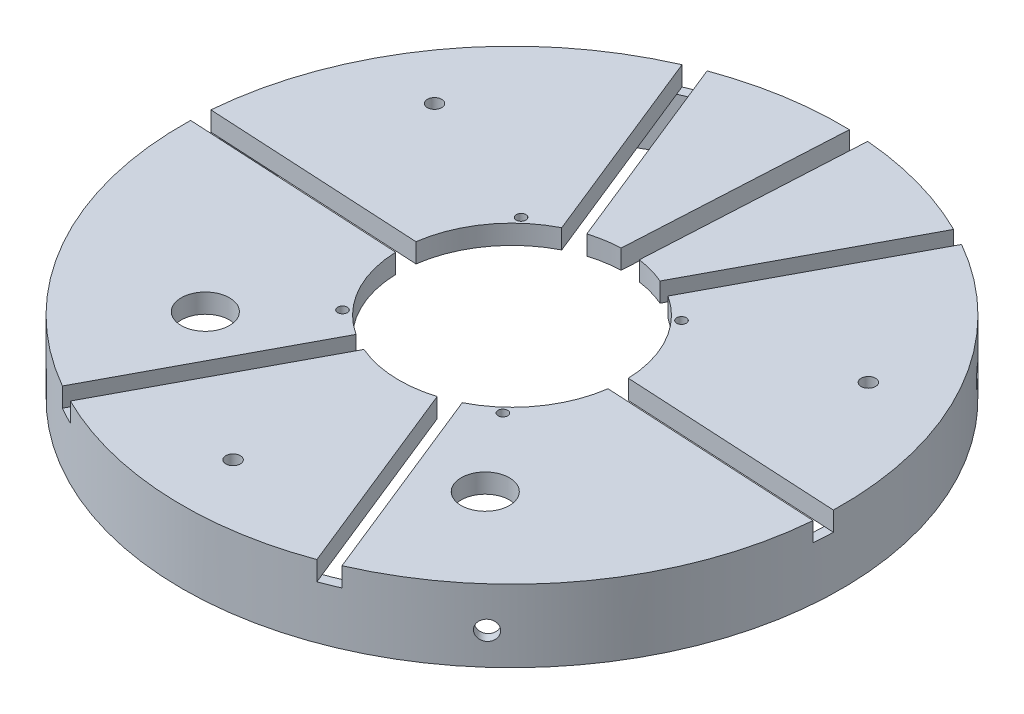
from build123d import *
from build123d.topology import SkipClean

# Parameters (mm, degrees)
SKETCH1_R                = 68.369999998
SKETCH1_R_2              = 23.401
BOSS_EXTRUDE1_DEPTH      = 2
BOSS_EXTRUDE2_START      = -13
SKETCH3_R                = 68.369999998
SKETCH3_R_2              = 66.37
BOSS_EXTRUDE2_DEPTH      = 13
CUT_EXTRUDE40_DEPTH      = 114.575806629
CUT_EXTRUDE40_DEPTH_BACK = 114.575806629
SKETCH63_R               = 2
CUT_EXTRUDE41_DEPTH      = 160.130961581
CUT_EXTRUDE41_DEPTH_BACK = 160.130961581
SKETCH64_R               = 2
CUT_EXTRUDE45_DEPTH      = 2
SKETCH73_R               = 1
CUT_EXTRUDE47_DEPTH      = 10
SKETCH70_R               = 1.5
CUT_EXTRUDE48_DEPTH      = 10
SKETCH74_R               = 5
CUT_EXTRUDE49_DEPTH      = 10
CUT_EXTRUDE51_DEPTH      = 2
SKETCH80_R               = 1.5
SKETCH80_R_2             = 5
SKETCH80_R_3             = 1
SKETCH80_R_4             = 23.401
BOSS_EXTRUDE4_DEPTH      = 2
CUT_EXTRUDE52_DEPTH      = 4


with BuildPart() as part:
    # Sketch1 → Boss-Extrude1 (new body)
    with BuildSketch(Plane(origin=(0, 0, 0), x_dir=(-0.9985653746512714, 0, -0.053546172109368295), z_dir=(0, 1, 0))):
        with Locations((55.498672647, -32.344920806)):
            Circle(SKETCH1_R)
        with Locations((55.498672647, -32.344920806)):
            Circle(SKETCH1_R_2, mode=Mode.SUBTRACT)
    extrude(amount=BOSS_EXTRUDE1_DEPTH)

    # Sketch3 → Boss-Extrude2 (add)
    with BuildSketch(Plane(origin=(0, 2, 0), x_dir=(1, 0, 0), z_dir=(0, 1, 0)).offset(BOSS_EXTRUDE2_START)):
        with Locations((-53.687106148, 35.27025944)):
            Circle(SKETCH3_R)
        with Locations((-53.687106148, 35.27025944)):
            Circle(SKETCH3_R_2, mode=Mode.SUBTRACT)
    extrude(amount=BOSS_EXTRUDE2_DEPTH)

    # Sketch63 → Cut-Extrude40 (cut, two sides: drawn at the far end of the back side and taken through both)
    with BuildSketch(Plane(origin=(-41.506941316, 0, -46.21062949), x_dir=(0.7439552092791144, 2.284460434874975e-13, -0.6682294864688846), z_dir=(0.6682294864688846, -2.5433421830845933e-13, 0.7439552092791144)).offset(-CUT_EXTRUDE40_DEPTH_BACK)):
        with Locations((-16.372174937, -4.35)):
            Circle(SKETCH63_R)
    extrude(amount=CUT_EXTRUDE40_DEPTH + CUT_EXTRUDE40_DEPTH_BACK, mode=Mode.SUBTRACT)

    # Sketch64 → Cut-Extrude41 (cut, two sides: drawn at the far end of the back side and taken through both)
    with BuildSketch(Plane(origin=(-12.180164832, 0, 10.94037005), x_dir=(-0.668229486468876, 1.5883353274739987e-15, -0.743955209279122), z_dir=(0.743955209279122, -1.7683301393964735e-15, -0.668229486468876)).offset(-CUT_EXTRUDE41_DEPTH_BACK)):
        with Locations((62.114800614, -4.35)):
            Circle(SKETCH64_R)
    extrude(amount=CUT_EXTRUDE41_DEPTH + CUT_EXTRUDE41_DEPTH_BACK, mode=Mode.SUBTRACT)

    # Sketch67 → Cut-Extrude45 (cut)
    with SkipClean():  # the faces are left unmerged after this step: merging them gives an invalid solid
        with BuildSketch(Plane(origin=(0, 2, 0), x_dir=(1, 0, 0), z_dir=(0, 1, 0))):
            with BuildLine():
                Line((-47.831144931, 125.709400378), (-49.82827568, 125.816492726))
                Line((-49.82827568, 125.816492726), (-52.215508738, 81.297751413))
                ThreePointArc((-52.215508738, 81.297751413), (-51.270489538, 80.245639864), (-50.218377989, 81.190659065))
                Line((-50.218377989, 81.190659065), (-47.831144931, 125.709400378))
            make_face()
            with BuildLine():
                Line((-144.126247086, 41.126220657), (-144.233339434, 39.129089908))
                Line((-144.233339434, 39.129089908), (-99.714598121, 36.741856849))
                ThreePointArc((-99.714598121, 36.741856849), (-98.662486572, 37.68687605), (-99.607505773, 38.738987598))
                Line((-99.607505773, 38.738987598), (-144.126247086, 41.126220657))
            make_face()
            with BuildLine():
                Line((36.75203479, 29.414298222), (36.859127139, 31.411428971))
                Line((36.859127139, 31.411428971), (-7.659614175, 33.79866203))
                ThreePointArc((-7.659614175, 33.79866203), (-8.711725723, 32.853642829), (-7.766706523, 31.801531281))
                Line((-7.766706523, 31.801531281), (36.75203479, 29.414298222))
            make_face()
        extrude(amount=-CUT_EXTRUDE45_DEPTH, mode=Mode.SUBTRACT)

    # Sketch73 → Cut-Extrude47 (cut)
    with SkipClean():  # the faces are left unmerged after this step: merging them gives an invalid solid
        with BuildSketch(Plane.XZ.offset(-2)):
            with Locations((-72.2141021, -18.632644766)):
                Circle(SKETCH73_R)
            with Locations((-37.049491474, -16.743263487)):
                Circle(SKETCH73_R)
            with Locations((-35.160110195, -51.907874114)):
                Circle(SKETCH73_R)
            with Locations((-70.324720822, -53.797255392)):
                Circle(SKETCH73_R)
        extrude(amount=CUT_EXTRUDE47_DEPTH, mode=Mode.SUBTRACT)

    # Sketch70 → Cut-Extrude48 (cut)
    with SkipClean():  # the faces are left unmerged after this step: merging them gives an invalid solid
        with BuildSketch(Plane(origin=(0, 2, 0), x_dir=(1, 0, 0), z_dir=(0, 1, 0))):
            with Locations((-99.774462502, 65.286181619)):
                Circle(SKETCH70_R)
            with Locations((-56.637979096, -19.650523046)):
                Circle(SKETCH70_R)
            with Locations((-4.648876845, 60.175119746)):
                Circle(SKETCH70_R)
        extrude(amount=-CUT_EXTRUDE48_DEPTH, mode=Mode.SUBTRACT)

    # Sketch74 → Cut-Extrude49 (cut)
    with SkipClean():  # the faces are left unmerged after this step: merging them gives an invalid solid
        with BuildSketch(Plane(origin=(19.562495047, 3, -2.053609117), x_dir=(1, 0, 0), z_dir=(0, 1, 0))):
            with Locations((-105.702188225, 2.042468777)):
                Circle(SKETCH74_R)
            with Locations((-44.324158759, -1.255349618)):
                Circle(SKETCH74_R)
        extrude(amount=-CUT_EXTRUDE49_DEPTH, mode=Mode.SUBTRACT)

    # Sketch75 → Cut-Extrude51 (cut)
    with SkipClean():  # the faces are left unmerged after this step: merging them gives an invalid solid
        with BuildSketch(Plane(origin=(0, 2, 0), x_dir=(1, 0, 0), z_dir=(0, 1, 0))):
            with BuildLine():
                Line((-76.23113034, -4.872889039), (-88.99361075, -28.801422216))
                Line((-88.99361075, -28.801422216), (-87.22892312, -29.74263291))
                Line((-87.22892312, -29.74263291), (-74.46644271, -5.814099732))
                ThreePointArc((-74.46644271, -5.814099732), (-74.878181178, -4.461150571), (-76.23113034, -4.872889039))
            make_face()
            with BuildLine():
                Line((-17.909140695, 104.475734373), (-32.907769586, 76.354618611))
                ThreePointArc((-32.907769586, 76.354618611), (-32.496031118, 75.00166945), (-31.143081956, 75.413407918))
                Line((-31.143081956, 75.413407918), (-18.010853699, 100.035185929))
                Line((-18.010853699, 100.035185929), (-17.909140695, 104.475734373))
            make_face()
            with BuildLine():
                Line((-83.573678256, 106.838580711), (-71.802851111, 77.596671772))
                ThreePointArc((-71.802851111, 77.596671772), (-70.501771538, 77.04242278), (-69.947522546, 78.343502353))
                Line((-69.947522546, 78.343502353), (-82.052949094, 108.416646442))
                Line((-82.052949094, 108.416646442), (-83.573678256, 106.838580711))
            make_face()
            with BuildLine():
                Line((-25.227483585, -32.753134346), (-35.571361185, -7.056152893))
                ThreePointArc((-35.571361185, -7.056152893), (-36.872440758, -6.501903901), (-37.42668975, -7.802983474))
                Line((-37.42668975, -7.802983474), (-27.08281215, -33.499964927))
                Line((-27.08281215, -33.499964927), (-25.227483585, -32.753134346))
            make_face()
        extrude(amount=-CUT_EXTRUDE51_DEPTH, mode=Mode.SUBTRACT)

    # Sketch80 → Boss-Extrude4 (add)
    with SkipClean():  # the faces are left unmerged after this step: merging them gives an invalid solid
        with BuildSketch(Plane(origin=(0, 2, 0), x_dir=(1, 0, 0), z_dir=(0, 1, 0))):
            with BuildLine():
                ThreePointArc((-80.142442845, 98.314466628), (-109.297160483, 75.044355993), (-121.89783813, 39.93426439))
                Line((-121.89783813, 39.93426439), (-99.607505773, 38.738987598))
                ThreePointArc((-99.607505773, 38.738987598), (-98.662486572, 37.68687605), (-99.714598121, 36.741856849))
                Line((-99.714598121, 36.741856849), (-122.005073337, 37.937141302))
                ThreePointArc((-122.005073337, 37.937141302), (-113.236504074, 1.679693704), (-86.741295726, -24.578528778))
                Line((-86.741295726, -24.578528778), (-76.23113034, -4.872889039))
                ThreePointArc((-76.23113034, -4.872889039), (-74.878181178, -4.461150571), (-74.46644271, -5.814099732))
                Line((-74.46644271, -5.814099732), (-84.976608096, -25.519739471))
                ThreePointArc((-84.976608096, -25.519739471), (-57.353015371, -33.00138921), (-29.087098016, -28.52077833))
                Line((-29.087098016, -28.52077833), (-37.42668975, -7.802983474))
                ThreePointArc((-37.42668975, -7.802983474), (-36.872440758, -6.501903901), (-35.571361185, -7.056152893))
                Line((-35.571361185, -7.056152893), (-27.231769451, -27.773947749))
                ThreePointArc((-27.231769451, -27.773947749), (1.922948187, -4.503837114), (14.523625835, 30.606254489))
                Line((14.523625835, 30.606254489), (-7.766706523, 31.801531281))
                ThreePointArc((-7.766706523, 31.801531281), (-8.711725723, 32.853642829), (-7.659614175, 33.79866203))
                Line((-7.659614175, 33.79866203), (14.630861042, 32.603377578))
                ThreePointArc((14.630861042, 32.603377578), (5.862291778, 68.860825176), (-20.63291657, 95.119047657))
                Line((-20.63291657, 95.119047657), (-31.143081956, 75.413407918))
                ThreePointArc((-31.143081956, 75.413407918), (-32.496031118, 75.00166945), (-32.907769586, 76.354618611))
                Line((-32.907769586, 76.354618611), (-22.397604199, 96.060258351))
                ThreePointArc((-22.397604199, 96.060258351), (-35.331439872, 101.130159344), (-49.023101197, 103.480991422))
                Line((-49.023101197, 103.480991422), (-50.218377989, 81.190659065))
                ThreePointArc((-50.218377989, 81.190659065), (-51.270489538, 80.245639864), (-52.215508738, 81.297751413))
                Line((-52.215508738, 81.297751413), (-51.020224286, 103.588226629))
                ThreePointArc((-51.020224286, 103.588226629), (-64.884819285, 102.71703935), (-78.28711428, 99.061297209))
                Line((-78.28711428, 99.061297209), (-69.947522546, 78.343502353))
                ThreePointArc((-69.947522546, 78.343502353), (-70.501771538, 77.04242278), (-71.802851111, 77.596671772))
                Line((-71.802851111, 77.596671772), (-80.142442845, 98.314466628))
            make_face()
            with Locations((-56.637979096, -19.650523046)):
                Circle(SKETCH80_R, mode=Mode.SUBTRACT)
            with Locations((-86.139693179, 4.096077895)):
                Circle(SKETCH80_R_2, mode=Mode.SUBTRACT)
            with Locations((-72.2141021, 18.632644766)):
                Circle(SKETCH80_R_3, mode=Mode.SUBTRACT)
            with Locations((-24.761663712, 0.798259499)):
                Circle(SKETCH80_R_2, mode=Mode.SUBTRACT)
            with Locations((-37.049491474, 16.743263487)):
                Circle(SKETCH80_R_3, mode=Mode.SUBTRACT)
            with Locations((-99.774462502, 65.286181619)):
                Circle(SKETCH80_R, mode=Mode.SUBTRACT)
            with Locations((-70.324720822, 53.797255392)):
                Circle(SKETCH80_R_3, mode=Mode.SUBTRACT)
            with Locations((-53.687106148, 35.27025944)):
                Circle(SKETCH80_R_4, mode=Mode.SUBTRACT)
            with Locations((-35.160110195, 51.907874114)):
                Circle(SKETCH80_R_3, mode=Mode.SUBTRACT)
            with Locations((-4.648876845, 60.175119746)):
                Circle(SKETCH80_R, mode=Mode.SUBTRACT)
        extrude(amount=BOSS_EXTRUDE4_DEPTH)

    # Sketch81 → Cut-Extrude52 (cut)
    with SkipClean():  # the faces are left unmerged after this step: merging them gives an invalid solid
        with BuildSketch(Plane(origin=(0, 4, 0), x_dir=(1, 0, 0), z_dir=(0, 1, 0))):
            Polygon((-81.072838115, 97.947835848), (-83.105922506, 102.998565747), (-79.395265376, 104.492226909), (-77.362180986, 99.441497009), (-26.30137418, -27.407316968), (-22.734468366, -36.268472921), (-26.445125496, -37.762134082), (-30.01203131, -28.90097813), align=None)
            Polygon((-52.018393691, 103.649147252), (-51.653563037, 110.443666916), (-47.65931687, 110.229196503), (-48.024147524, 103.434676839), (-50.810013502, 51.551368884), (-54.804259669, 51.765839297), align=None)
            Polygon((-84.097706073, -25.996797875), (-86.947203549, -31.339356117), (-90.476578808, -29.45693473), (-87.627081332, -24.114376488), (-23.276506223, 96.537316754), (-19.165494643, 104.245103472), (-15.636119383, 102.362682086), (-19.747130964, 94.654895367), align=None)
            Polygon((14.691781665, 33.601546982), (23.445859555, 33.131498161), (23.231389142, 29.137251994), (14.477311252, 29.607300815), (-122.065993961, 36.938971897), (-130.097962601, 37.370247177), (-129.883492188, 41.364493344), (-121.851523547, 40.933218064), align=None)
        extrude(amount=-CUT_EXTRUDE52_DEPTH, mode=Mode.SUBTRACT)


solid = part.part
